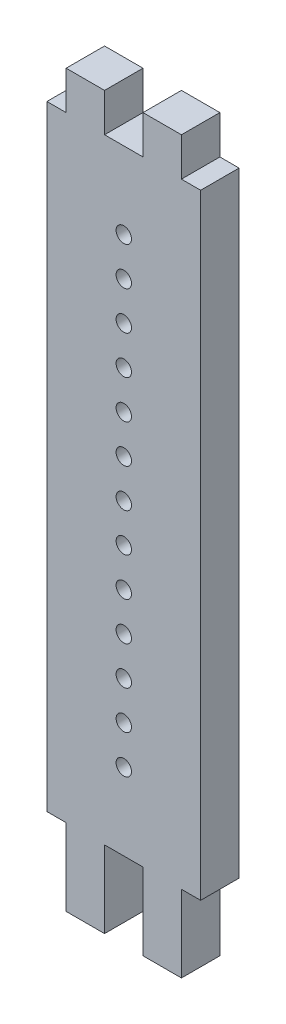
from build123d import *

# Parameters (mm, degrees)
SKETCH1_R           = 1
BOSS_EXTRUDE1_DEPTH = 5


with BuildPart() as part:
    # Sketch1 → Boss-Extrude1 (new body)
    with BuildSketch(Plane.XY):
        Polygon((-7.5, 40), (-7.5, 45), (-2.5, 45), (-2.5, 40), (2.5, 40), (2.5, 45), (7.5, 45), (7.5, 40), (10, 40), (10, -40), (7.5, -40), (7.5, -50), (2.5, -50), (2.5, -45), (2.5, -40), (-2.5, -40), (-2.5, -50), (-7.5, -50), (-7.5, -45), (-7.5, -40), (-10, -40), (-10, 40), align=None)
        Circle(SKETCH1_R, mode=Mode.SUBTRACT)
        with Locations((0, 10)):
            Circle(SKETCH1_R, mode=Mode.SUBTRACT)
        with Locations((0, 20)):
            Circle(SKETCH1_R, mode=Mode.SUBTRACT)
        with Locations((0, 30)):
            Circle(SKETCH1_R, mode=Mode.SUBTRACT)
        with Locations((0, 5)):
            Circle(SKETCH1_R, mode=Mode.SUBTRACT)
        with Locations((0, 15)):
            Circle(SKETCH1_R, mode=Mode.SUBTRACT)
        with Locations((0, 25)):
            Circle(SKETCH1_R, mode=Mode.SUBTRACT)
        with Locations((0, -25)):
            Circle(SKETCH1_R, mode=Mode.SUBTRACT)
        with Locations((0, -15)):
            Circle(SKETCH1_R, mode=Mode.SUBTRACT)
        with Locations((0, -5)):
            Circle(SKETCH1_R, mode=Mode.SUBTRACT)
        with Locations((0, -30)):
            Circle(SKETCH1_R, mode=Mode.SUBTRACT)
        with Locations((0, -20)):
            Circle(SKETCH1_R, mode=Mode.SUBTRACT)
        with Locations((0, -10)):
            Circle(SKETCH1_R, mode=Mode.SUBTRACT)
    extrude(amount=BOSS_EXTRUDE1_DEPTH)


solid = part.part
